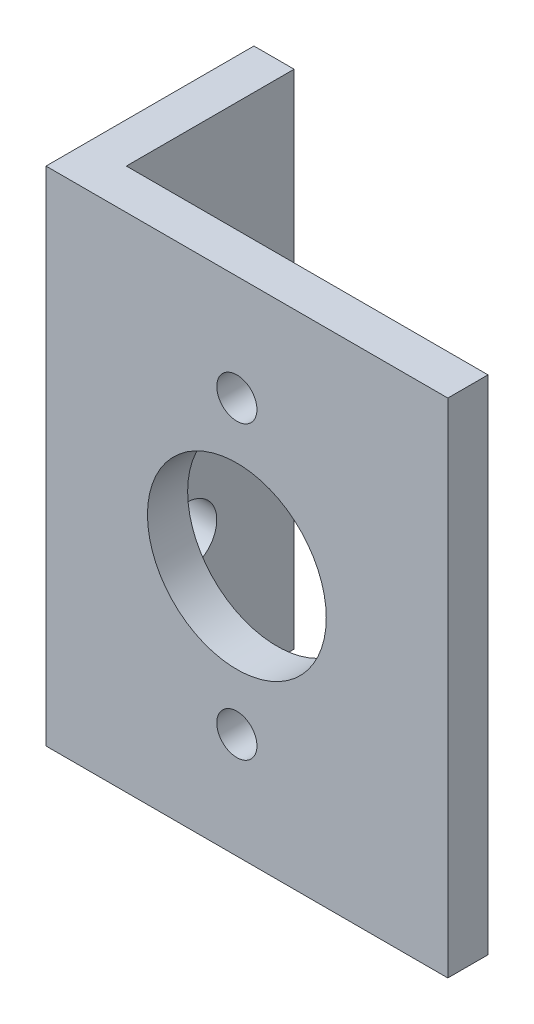
from build123d import *

# Parameters (mm, degrees)
EXTRUDE_1_DEPTH     = 50
SKETCH_2_R          = 3
CUT_EXTRUDE_1_DEPTH = 4
SKETCH_3_R          = 8.9
SKETCH_3_R_2        = 2
CUT_EXTRUDE_2_DEPTH = 4


with BuildPart() as part:
    # Эскиз1 → Бобышка-Вытянуть1 (new body)
    with BuildSketch(Plane(origin=(0, 0, 0), x_dir=(1, 0, 0), z_dir=(0, 1, 0))):
        Polygon((0, 0), (40, 0), (40, 4), (4, 4), (4, 20.7), (0, 20.7), (0, 4), align=None)
    extrude(amount=EXTRUDE_1_DEPTH)

    # Эскиз2 → Вырез-Вытянуть1 (cut)
    with BuildSketch(Plane.ZY):
        with Locations((-10, 35)):
            Circle(SKETCH_2_R)
        with Locations((-10, 15)):
            Circle(SKETCH_2_R)
    extrude(amount=-CUT_EXTRUDE_1_DEPTH, mode=Mode.SUBTRACT)

    # Эскиз3 → Вырез-Вытянуть2 (cut)
    with BuildSketch(Plane(origin=(0, 0, -4), x_dir=(-1, 0, 0), z_dir=(0, 0, -1))):
        with Locations((-19, 25)):
            Circle(SKETCH_3_R)
        with Locations((-19, 39.5)):
            Circle(SKETCH_3_R_2)
        with Locations((-19, 10.5)):
            Circle(SKETCH_3_R_2)
    extrude(amount=-CUT_EXTRUDE_2_DEPTH, mode=Mode.SUBTRACT)


solid = part.part
